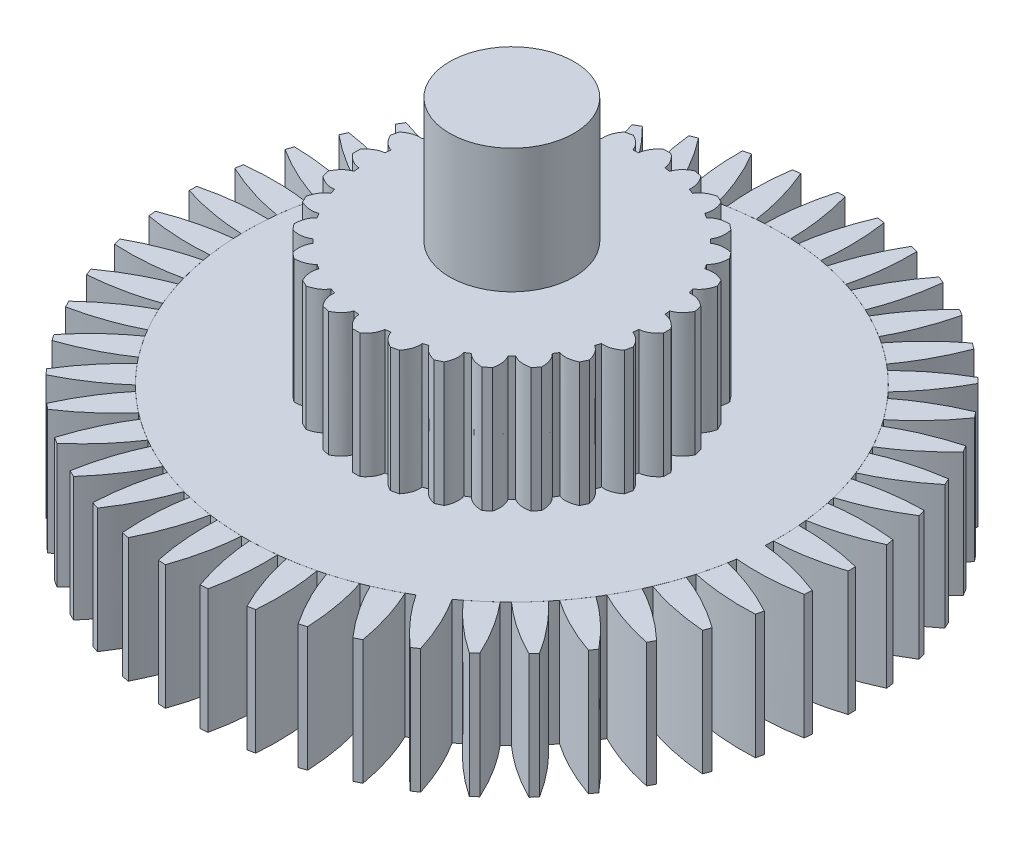
from build123d import *

# Parameters (mm, degrees)
BOSS_EXTRUDE1_DEPTH    = 1
BOSS_EXTRUDE1_2_DEPTH  = 1
BOSS_EXTRUDE1_3_DEPTH  = 1
BOSS_EXTRUDE1_4_DEPTH  = 1
BOSS_EXTRUDE1_5_DEPTH  = 1
BOSS_EXTRUDE1_6_DEPTH  = 1
BOSS_EXTRUDE1_7_DEPTH  = 1
BOSS_EXTRUDE1_8_DEPTH  = 1
BOSS_EXTRUDE1_9_DEPTH  = 1
BOSS_EXTRUDE1_10_DEPTH = 1
BOSS_EXTRUDE1_11_DEPTH = 1
BOSS_EXTRUDE1_12_DEPTH = 1
BOSS_EXTRUDE1_13_DEPTH = 1
BOSS_EXTRUDE1_14_DEPTH = 1
BOSS_EXTRUDE1_15_DEPTH = 1
BOSS_EXTRUDE1_16_DEPTH = 1
BOSS_EXTRUDE1_17_DEPTH = 1
BOSS_EXTRUDE1_18_DEPTH = 1
BOSS_EXTRUDE1_19_DEPTH = 1
BOSS_EXTRUDE1_20_DEPTH = 1
BOSS_EXTRUDE1_21_DEPTH = 1
BOSS_EXTRUDE1_22_DEPTH = 1
BOSS_EXTRUDE1_23_DEPTH = 1
BOSS_EXTRUDE1_24_DEPTH = 1
BOSS_EXTRUDE1_25_DEPTH = 1
BOSS_EXTRUDE1_26_DEPTH = 1
BOSS_EXTRUDE1_27_DEPTH = 1
BOSS_EXTRUDE1_28_DEPTH = 1
BOSS_EXTRUDE1_29_DEPTH = 1
BOSS_EXTRUDE1_30_DEPTH = 1
BOSS_EXTRUDE1_31_DEPTH = 1
BOSS_EXTRUDE1_32_DEPTH = 1
BOSS_EXTRUDE1_33_DEPTH = 1
BOSS_EXTRUDE1_34_DEPTH = 1
BOSS_EXTRUDE1_35_DEPTH = 1
BOSS_EXTRUDE1_36_DEPTH = 1
BOSS_EXTRUDE1_37_DEPTH = 1
BOSS_EXTRUDE1_38_DEPTH = 1
BOSS_EXTRUDE1_39_DEPTH = 1
BOSS_EXTRUDE1_40_DEPTH = 1
BOSS_EXTRUDE1_41_DEPTH = 1
BOSS_EXTRUDE1_42_DEPTH = 1
BOSS_EXTRUDE1_43_DEPTH = 1
BOSS_EXTRUDE1_44_DEPTH = 1
BOSS_EXTRUDE1_45_DEPTH = 1
BOSS_EXTRUDE1_46_DEPTH = 1
BOSS_EXTRUDE1_47_DEPTH = 1
BOSS_EXTRUDE1_48_DEPTH = 1
SKETCH2_R              = 1.13
BOSS_EXTRUDE11_DEPTH   = 1
BOSS_EXTRUDE12_DEPTH   = 1
SKETCH4_R              = 0.5
BOSS_EXTRUDE13_DEPTH   = 1
SKETCH5_R              = 0.5
BOSS_EXTRUDE14_DEPTH   = 1


with BuildPart() as part:
    # Sketch1 → Boss-Extrude1 (new body)
    with BuildSketch(Plane(origin=(0, 0, 0), x_dir=(1, 0, 0), z_dir=(0, 1, 0))):
        with BuildLine():
            Line((0.03, 2.65), (-0.03, 2.65))
            add(Edge.make_bspline(
                [(-0.03, 2.65), (-0.102282286, 2.396242435), (-0.105, 2.137422513)],
                knots=[0, 0, 0, 0.92752764, 0.92752764, 0.92752764], degree=2))
            ThreePointArc((-0.105, 2.137422513), (-0.052515815, 2.139355531), (0, 2.14))
            ThreePointArc((0, 2.14), (0.052515815, 2.139355531), (0.105, 2.137422513))
            add(Edge.make_bspline(
                [(0.03, 2.65), (0.102282286, 2.396242435), (0.105, 2.137422513)],
                knots=[0, 0, 0, 0.92752764, 0.92752764, 0.92752764], degree=2))
        make_face()
    extrude(amount=BOSS_EXTRUDE1_DEPTH)


with BuildPart() as body_2:
    # Sketch1 → Boss-Extrude1 2 (new body)
    with BuildSketch(Plane(origin=(0, 0, 0), x_dir=(1, 0, 0), z_dir=(0, 1, 0))):
        with BuildLine():
            Line((0, 2.14), (-0.105, 2.137422513))
            ThreePointArc((-0.105, 2.137422513), (-0.137110271, 2.13560314), (-0.169189573, 2.133301406))
            Line((-0.169189573, 2.133301406), (-0.273657126, 2.12243063))
            Line((-0.273657126, 2.12243063), (-0.377465476, 2.106447202))
            ThreePointArc((-0.377465476, 2.106447202), (-0.409079465, 2.100536596), (-0.440601058, 2.094151548))
            Line((-0.440601058, 2.094151548), (-0.54282081, 2.070011007))
            Line((-0.54282081, 2.070011007), (-0.643732979, 2.040884086))
            ThreePointArc((-0.643732979, 2.040884086), (-0.674331587, 2.030979299), (-0.704777885, 2.020615781))
            Line((-0.704777885, 2.020615781), (-0.80307139, 1.983601861))
            Line((-0.80307139, 1.983601861), (-0.899430404, 1.94180971))
            ThreePointArc((-0.899430404, 1.94180971), (-0.928511202, 1.928073377), (-0.957382279, 1.913901557))
            Line((-0.957382279, 1.913901557), (-1.050135561, 1.864622027))
            Line((-1.050135561, 1.864622027), (-1.140359207, 1.810850871))
            ThreePointArc((-1.140359207, 1.810850871), (-1.167444689, 1.793508544), (-1.194266483, 1.775761123))
            Line((-1.194266483, 1.775761123), (-1.279956535, 1.715025151))
            Line((-1.279956535, 1.715025151), (-1.362563344, 1.650157912))
            ThreePointArc((-1.362563344, 1.650157912), (-1.387208766, 1.629494351), (-1.411540864, 1.608462741))
            Line((-1.411540864, 1.608462741), (-1.488760658, 1.537267609))
            Line((-1.488760658, 1.537267609), (-1.562394227, 1.462369405))
            ThreePointArc((-1.562394227, 1.462369405), (-1.584194914, 1.438723905), (-1.605637783, 1.414753445))
            Line((-1.605637783, 1.414753445), (-1.673119372, 1.334268176))
            Line((-1.673119372, 1.334268176), (-1.736570641, 1.250568834))
            ThreePointArc((-1.736570641, 1.250568834), (-1.755168625, 1.224329653), (-1.773370174, 1.197813936))
            Line((-1.773370174, 1.197813936), (-1.830005513, 1.109360096))
            Line((-1.830005513, 1.109360096), (-1.882232613, 1.018233956))
            ThreePointArc((-1.882232613, 1.018233956), (-1.897322516, 0.989831941), (-1.911983876, 0.961206356))
            Line((-1.911983876, 0.961206356), (-1.956843013, 0.866236354))
            Line((-1.956843013, 0.866236354), (-1.996988378, 0.769179705))
            ThreePointArc((-1.996988378, 0.769179705), (-2.008322423, 0.739081216), (-2.019202855, 0.708815794))
            Line((-2.019202855, 0.708815794), (-2.051549205, 0.608889035))
            Line((-2.051549205, 0.608889035), (-2.078953648, 0.507495545))
            ThreePointArc((-2.078953648, 0.507495545), (-2.086345732, 0.476194799), (-2.09326658, 0.444786496))
            Line((-2.09326658, 0.444786496), (-2.112569017, 0.341543775))
            Line((-2.112569017, 0.341543775), (-2.126782557, 0.237478321))
            ThreePointArc((-2.126782557, 0.237478321), (-2.130111302, 0.205489275), (-2.132958925, 0.173453816))
            Line((-2.132958925, 0.173453816), (-2.138900503, 0.068590376))
            Line((-2.138900503, 0.068590376), (-2.139689756, -0.036438289))
            ThreePointArc((-2.139689756, -0.036438289), (-2.138900503, -0.068590376), (-2.137628143, -0.100726971))
            Line((-2.137628143, -0.100726971), (-2.130111302, -0.205489275))
            Line((-2.130111302, -0.205489275), (-2.117463307, -0.309756584))
            ThreePointArc((-2.117463307, -0.309756584), (-2.112569017, -0.341543775), (-2.107197566, -0.373253823))
            Line((-2.107197566, -0.373253823), (-2.086345732, -0.476194799))
            Line((-2.086345732, -0.476194799), (-2.06046817, -0.577988685))
            ThreePointArc((-2.06046817, -0.577988685), (-2.051549205, -0.608889035), (-2.042166864, -0.639651858))
            Line((-2.042166864, -0.639651858), (-2.008322423, -0.739081216))
            Line((-2.008322423, -0.739081216), (-1.969640203, -0.836730227))
            ThreePointArc((-1.969640203, -0.836730227), (-1.956843013, -0.866236354), (-1.943603838, -0.895546828))
            Line((-1.943603838, -0.895546828), (-1.897322516, -0.989831941))
            Line((-1.897322516, -0.989831941), (-1.846470797, -1.081732682))
            ThreePointArc((-1.846470797, -1.081732682), (-1.830005513, -1.109360096), (-1.813126891, -1.136736943))
            Line((-1.813126891, -1.136736943), (-1.755168625, -1.224329653))
            Line((-1.755168625, -1.224329653), (-1.692982392, -1.308973116))
            ThreePointArc((-1.692982392, -1.308973116), (-1.673119372, -1.334268176), (-1.65287845, -1.359261869))
            Line((-1.65287845, -1.359261869), (-1.584194914, -1.438723905))
            Line((-1.584194914, -1.438723905), (-1.511695264, -1.514720248))
            ThreePointArc((-1.511695264, -1.514720248), (-1.488760658, -1.537267609), (-1.465489791, -1.559467753))
            Line((-1.465489791, -1.559467753), (-1.387208766, -1.629494351))
            Line((-1.387208766, -1.629494351), (-1.30558614, -1.695595716))
            ThreePointArc((-1.30558614, -1.695595716), (-1.279956535, -1.715025151), (-1.254037831, -1.734067219))
            Line((-1.254037831, -1.734067219), (-1.167444689, -1.793508544))
            Line((-1.167444689, -1.793508544), (-1.078039329, -1.848629548))
            ThreePointArc((-1.078039329, -1.848629548), (-1.050135561, -1.864622027), (-1.021994603, -1.880193349))
            Line((-1.021994603, -1.880193349), (-0.928511202, -1.928073377))
            Line((-0.928511202, -1.928073377), (-0.832791141, -1.971308935))
            ThreePointArc((-0.832791141, -1.971308935), (-0.80307139, -1.983601861), (-0.773170253, -1.995446757))
            Line((-0.773170253, -1.995446757), (-0.674331587, -2.030979299))
            Line((-0.674331587, -2.030979299), (-0.573868546, -2.061619483))
            ThreePointArc((-0.573868546, -2.061619483), (-0.54282081, -2.070011007), (-0.511650468, -2.077934984))
            Line((-0.511650468, -2.077934984), (-0.409079465, -2.100536596))
            Line((-0.409079465, -2.100536596), (-0.305523045, -2.118078296))
            ThreePointArc((-0.305523045, -2.118078296), (-0.273657126, -2.12243063), (-0.241729397, -2.126303576))
            Line((-0.241729397, -2.126303576), (-0.137110271, -2.13560314))
            Line((-0.137110271, -2.13560314), (-0.032160864, -2.139758323))
            ThreePointArc((-0.032160864, -2.139758323), (0, -2.14), (0.032160864, -2.139758323))
            Line((0.032160864, -2.139758323), (0.137110271, -2.13560314))
            Line((0.137110271, -2.13560314), (0.241729397, -2.126303576))
            ThreePointArc((0.241729397, -2.126303576), (0.273657126, -2.12243063), (0.305523045, -2.118078296))
            Line((0.305523045, -2.118078296), (0.409079465, -2.100536596))
            Line((0.409079465, -2.100536596), (0.511650468, -2.077934984))
            ThreePointArc((0.511650468, -2.077934984), (0.54282081, -2.070011007), (0.573868546, -2.061619483))
            Line((0.573868546, -2.061619483), (0.674331587, -2.030979299))
            Line((0.674331587, -2.030979299), (0.773170253, -1.995446757))
            ThreePointArc((0.773170253, -1.995446757), (0.80307139, -1.983601861), (0.832791141, -1.971308935))
            Line((0.832791141, -1.971308935), (0.928511202, -1.928073377))
            Line((0.928511202, -1.928073377), (1.021994603, -1.880193349))
            ThreePointArc((1.021994603, -1.880193349), (1.050135561, -1.864622027), (1.078039329, -1.848629548))
            add(Edge.make_bspline(
                [(1.420524845, -2.237299525), (1.221512313, -2.064060838), (1.078039329, -1.848629548)],
                knots=[0, 0, 0, 0.92752764, 0.92752764, 0.92752764], degree=2))
            Line((1.420524845, -2.237299525), (1.470810131, -2.204567431))
            add(Edge.make_bspline(
                [(1.470810131, -2.204567431), (1.392955447, -1.952463725), (1.254037831, -1.734067219)],
                knots=[0, 0, 0, 0.92752764, 0.92752764, 0.92752764], degree=2))
            ThreePointArc((1.254037831, -1.734067219), (1.279956535, -1.715025151), (1.30558614, -1.695595716))
            Line((1.30558614, -1.695595716), (1.387208766, -1.629494351))
            Line((1.387208766, -1.629494351), (1.465489791, -1.559467753))
            ThreePointArc((1.465489791, -1.559467753), (1.488760658, -1.537267609), (1.511695264, -1.514720248))
            Line((1.511695264, -1.514720248), (1.584194914, -1.438723905))
            Line((1.584194914, -1.438723905), (1.65287845, -1.359261869))
            ThreePointArc((1.65287845, -1.359261869), (1.673119372, -1.334268176), (1.692982392, -1.308973116))
            Line((1.692982392, -1.308973116), (1.755168625, -1.224329653))
            Line((1.755168625, -1.224329653), (1.813126891, -1.136736943))
            ThreePointArc((1.813126891, -1.136736943), (1.830005513, -1.109360096), (1.846470797, -1.081732682))
            Line((1.846470797, -1.081732682), (1.897322516, -0.989831941))
            Line((1.897322516, -0.989831941), (1.943603838, -0.895546828))
            ThreePointArc((1.943603838, -0.895546828), (1.956843013, -0.866236354), (1.969640203, -0.836730227))
            Line((1.969640203, -0.836730227), (2.008322423, -0.739081216))
            Line((2.008322423, -0.739081216), (2.042166864, -0.639651858))
            ThreePointArc((2.042166864, -0.639651858), (2.051549205, -0.608889035), (2.06046817, -0.577988685))
            Line((2.06046817, -0.577988685), (2.086345732, -0.476194799))
            Line((2.086345732, -0.476194799), (2.107197566, -0.373253823))
            ThreePointArc((2.107197566, -0.373253823), (2.112569017, -0.341543775), (2.117463307, -0.309756584))
            add(Edge.make_bspline(
                [(2.634873959, -0.284322392), (2.375348215, -0.3319041), (2.117463307, -0.309756584)],
                knots=[0, 0, 0, 0.92752764, 0.92752764, 0.92752764], degree=2))
            Line((2.634873959, -0.284322392), (2.64063534, -0.224599645))
            add(Edge.make_bspline(
                [(2.64063534, -0.224599645), (2.394991124, -0.128284799), (2.137628143, -0.100726971)],
                knots=[0, 0, 0, 0.92752764, 0.92752764, 0.92752764], degree=2))
            ThreePointArc((2.137628143, -0.100726971), (2.138900503, -0.068590376), (2.139689756, -0.036438289))
            Line((2.139689756, -0.036438289), (2.138900503, 0.068590376))
            Line((2.138900503, 0.068590376), (2.132958925, 0.173453816))
            ThreePointArc((2.132958925, 0.173453816), (2.130111302, 0.205489275), (2.126782557, 0.237478321))
            Line((2.126782557, 0.237478321), (2.112569017, 0.341543775))
            Line((2.112569017, 0.341543775), (2.09326658, 0.444786496))
            ThreePointArc((2.09326658, 0.444786496), (2.086345732, 0.476194799), (2.078953648, 0.507495545))
            Line((2.078953648, 0.507495545), (2.051549205, 0.608889035))
            Line((2.051549205, 0.608889035), (2.019202855, 0.708815794))
            ThreePointArc((2.019202855, 0.708815794), (2.008322423, 0.739081216), (1.996988378, 0.769179705))
            Line((1.996988378, 0.769179705), (1.956843013, 0.866236354))
            Line((1.956843013, 0.866236354), (1.911983876, 0.961206356))
            ThreePointArc((1.911983876, 0.961206356), (1.897322516, 0.989831941), (1.882232613, 1.018233956))
            Line((1.882232613, 1.018233956), (1.830005513, 1.109360096))
            Line((1.830005513, 1.109360096), (1.773370174, 1.197813936))
            ThreePointArc((1.773370174, 1.197813936), (1.755168625, 1.224329653), (1.736570641, 1.250568834))
            Line((1.736570641, 1.250568834), (1.673119372, 1.334268176))
            Line((1.673119372, 1.334268176), (1.605637783, 1.414753445))
            ThreePointArc((1.605637783, 1.414753445), (1.584194914, 1.438723905), (1.562394227, 1.462369405))
            Line((1.562394227, 1.462369405), (1.488760658, 1.537267609))
            Line((1.488760658, 1.537267609), (1.411540864, 1.608462741))
            ThreePointArc((1.411540864, 1.608462741), (1.387208766, 1.629494351), (1.362563344, 1.650157912))
            Line((1.362563344, 1.650157912), (1.279956535, 1.715025151))
            Line((1.279956535, 1.715025151), (1.194266483, 1.775761123))
            ThreePointArc((1.194266483, 1.775761123), (1.167444689, 1.793508544), (1.140359207, 1.810850871))
            Line((1.140359207, 1.810850871), (1.050135561, 1.864622027))
            Line((1.050135561, 1.864622027), (0.957382279, 1.913901557))
            ThreePointArc((0.957382279, 1.913901557), (0.928511202, 1.928073377), (0.899430404, 1.94180971))
            Line((0.899430404, 1.94180971), (0.80307139, 1.983601861))
            Line((0.80307139, 1.983601861), (0.704777885, 2.020615781))
            ThreePointArc((0.704777885, 2.020615781), (0.674331587, 2.030979299), (0.643732979, 2.040884086))
            Line((0.643732979, 2.040884086), (0.54282081, 2.070011007))
            Line((0.54282081, 2.070011007), (0.440601058, 2.094151548))
            ThreePointArc((0.440601058, 2.094151548), (0.409079465, 2.100536596), (0.377465476, 2.106447202))
            Line((0.377465476, 2.106447202), (0.273657126, 2.12243063))
            Line((0.273657126, 2.12243063), (0.169189573, 2.133301406))
            ThreePointArc((0.169189573, 2.133301406), (0.137110271, 2.13560314), (0.105, 2.137422513))
            Line((0.105, 2.137422513), (0, 2.14))
        make_face()
    extrude(amount=BOSS_EXTRUDE1_2_DEPTH)

    # Sketch2 → Boss-Extrude11 (add)
    with BuildSketch(Plane(origin=(0, 1, 0), x_dir=(1, 0, 0), z_dir=(0, 1, 0))):
        Circle(SKETCH2_R)
    extrude(amount=BOSS_EXTRUDE11_DEPTH)

    # Sketch3 → Boss-Extrude12 (add)
    with BuildSketch(Plane(origin=(0, 2, 0), x_dir=(1, 0, 0), z_dir=(0, 1, 0))):
        with BuildLine():
            Line((-0.03, 1.25), (0.03, 1.25))
            add(Edge.make_bspline(
                [(0.03, 1.25), (0.100427355, 1.19375975), (0.105, 1.119897168)],
                knots=[0, 0, 0, 0.878062799, 0.878062799, 0.878062799], degree=2))
            Line((0.105, 1.119897168), (0, 1.13))
            Line((0, 1.13), (-0.105, 1.119897168))
            add(Edge.make_bspline(
                [(-0.03, 1.25), (-0.100427355, 1.19375975), (-0.105, 1.119897168)],
                knots=[0, 0, 0, 0.878062799, 0.878062799, 0.878062799], degree=2))
        make_face()
        with BuildLine():
            Line((0.24890333, 1.225335518), (0.307399005, 1.211984262))
            add(Edge.make_bspline(
                [(0.307399005, 1.211984262), (0.363545966, 1.141482512), (0.351567995, 1.06845431)],
                knots=[0, 0, 0, 0.878062799, 0.878062799, 0.878062799], degree=2))
            Line((0.351567995, 1.06845431), (0.251448655, 1.101668541))
            Line((0.251448655, 1.101668541), (0.146833133, 1.115183706))
            add(Edge.make_bspline(
                [(0.24890333, 1.225335518), (0.167727103, 1.18617689), (0.146833133, 1.115183706)],
                knots=[0, 0, 0, 0.878062799, 0.878062799, 0.878062799], degree=2))
        make_face()
        with BuildLine():
            Line((0.515325608, 1.139227597), (0.56938374, 1.113194573))
            add(Edge.make_bspline(
                [(0.56938374, 1.113194573), (0.608434864, 1.031966575), (0.580506902, 0.963434691)],
                knots=[0, 0, 0, 0.878062799, 0.878062799, 0.878062799], degree=2))
            Line((0.580506902, 0.963434691), (0.490288625, 1.018094821))
            Line((0.490288625, 1.018094821), (0.39130344, 1.054550276))
            add(Edge.make_bspline(
                [(0.515325608, 1.139227597), (0.427471024, 1.119114167), (0.39130344, 1.054550276)],
                knots=[0, 0, 0, 0.878062799, 0.878062799, 0.878062799], degree=2))
        make_face()
        with BuildLine():
            Line((0.755907308, 0.995994047), (0.802817197, 0.958584659))
            add(Edge.make_bspline(
                [(0.802817197, 0.958584659), (0.822814298, 0.870703524), (0.780336769, 0.810104434)],
                knots=[0, 0, 0, 0.878062799, 0.878062799, 0.878062799], degree=2))
            Line((0.780336769, 0.810104434), (0.704543476, 0.883469575))
            Line((0.704543476, 0.883469575), (0.616152158, 0.941037292))
            add(Edge.make_bspline(
                [(0.755907308, 0.995994047), (0.665779762, 0.995934387), (0.616152158, 0.941037292)],
                knots=[0, 0, 0, 0.878062799, 0.878062799, 0.878062799], degree=2))
        make_face()
        with BuildLine():
            Line((0.958584659, 0.802817197), (0.995994047, 0.755907308))
            add(Edge.make_bspline(
                [(0.995994047, 0.755907308), (0.995934387, 0.665779762), (0.941037292, 0.616152158)],
                knots=[0, 0, 0, 0.878062799, 0.878062799, 0.878062799], degree=2))
            Line((0.941037292, 0.616152158), (0.883469575, 0.704543476))
            Line((0.883469575, 0.704543476), (0.810104434, 0.780336769))
            add(Edge.make_bspline(
                [(0.958584659, 0.802817197), (0.870703524, 0.822814298), (0.810104434, 0.780336769)],
                knots=[0, 0, 0, 0.878062799, 0.878062799, 0.878062799], degree=2))
        make_face()
        with BuildLine():
            Line((1.113194573, 0.56938374), (1.139227597, 0.515325608))
            add(Edge.make_bspline(
                [(1.139227597, 0.515325608), (1.119114167, 0.427471024), (1.054550276, 0.39130344)],
                knots=[0, 0, 0, 0.878062799, 0.878062799, 0.878062799], degree=2))
            Line((1.054550276, 0.39130344), (1.018094821, 0.490288625))
            Line((1.018094821, 0.490288625), (0.963434691, 0.580506902))
            add(Edge.make_bspline(
                [(1.113194573, 0.56938374), (1.031966575, 0.608434864), (0.963434691, 0.580506902)],
                knots=[0, 0, 0, 0.878062799, 0.878062799, 0.878062799], degree=2))
        make_face()
        with BuildLine():
            Line((1.211984262, 0.307399005), (1.225335518, 0.24890333))
            add(Edge.make_bspline(
                [(1.225335518, 0.24890333), (1.18617689, 0.167727103), (1.115183706, 0.146833133)],
                knots=[0, 0, 0, 0.878062799, 0.878062799, 0.878062799], degree=2))
            Line((1.115183706, 0.146833133), (1.101668541, 0.251448655))
            Line((1.101668541, 0.251448655), (1.06845431, 0.351567995))
            add(Edge.make_bspline(
                [(1.211984262, 0.307399005), (1.141482512, 0.363545966), (1.06845431, 0.351567995)],
                knots=[0, 0, 0, 0.878062799, 0.878062799, 0.878062799], degree=2))
        make_face()
        with BuildLine():
            Line((1.25, 0.03), (1.25, -0.03))
            add(Edge.make_bspline(
                [(1.25, -0.03), (1.19375975, -0.100427355), (1.119897168, -0.105)],
                knots=[0, 0, 0, 0.878062799, 0.878062799, 0.878062799], degree=2))
            Line((1.119897168, -0.105), (1.13, 0))
            Line((1.13, 0), (1.119897168, 0.105))
            add(Edge.make_bspline(
                [(1.25, 0.03), (1.19375975, 0.100427355), (1.119897168, 0.105)],
                knots=[0, 0, 0, 0.878062799, 0.878062799, 0.878062799], degree=2))
        make_face()
        with BuildLine():
            Line((1.225335518, -0.24890333), (1.211984262, -0.307399005))
            add(Edge.make_bspline(
                [(1.211984262, -0.307399005), (1.141482512, -0.363545966), (1.06845431, -0.351567995)],
                knots=[0, 0, 0, 0.878062799, 0.878062799, 0.878062799], degree=2))
            Line((1.06845431, -0.351567995), (1.101668541, -0.251448655))
            Line((1.101668541, -0.251448655), (1.115183706, -0.146833133))
            add(Edge.make_bspline(
                [(1.225335518, -0.24890333), (1.18617689, -0.167727103), (1.115183706, -0.146833133)],
                knots=[0, 0, 0, 0.878062799, 0.878062799, 0.878062799], degree=2))
        make_face()
        with BuildLine():
            Line((1.139227597, -0.515325608), (1.113194573, -0.56938374))
            add(Edge.make_bspline(
                [(1.113194573, -0.56938374), (1.031966575, -0.608434864), (0.963434691, -0.580506902)],
                knots=[0, 0, 0, 0.878062799, 0.878062799, 0.878062799], degree=2))
            Line((0.963434691, -0.580506902), (1.018094821, -0.490288625))
            Line((1.018094821, -0.490288625), (1.054550276, -0.39130344))
            add(Edge.make_bspline(
                [(1.139227597, -0.515325608), (1.119114167, -0.427471024), (1.054550276, -0.39130344)],
                knots=[0, 0, 0, 0.878062799, 0.878062799, 0.878062799], degree=2))
        make_face()
        with BuildLine():
            Line((0.995994047, -0.755907308), (0.958584659, -0.802817197))
            add(Edge.make_bspline(
                [(0.958584659, -0.802817197), (0.870703524, -0.822814298), (0.810104434, -0.780336769)],
                knots=[0, 0, 0, 0.878062799, 0.878062799, 0.878062799], degree=2))
            Line((0.810104434, -0.780336769), (0.883469575, -0.704543476))
            Line((0.883469575, -0.704543476), (0.941037292, -0.616152158))
            add(Edge.make_bspline(
                [(0.995994047, -0.755907308), (0.995934387, -0.665779762), (0.941037292, -0.616152158)],
                knots=[0, 0, 0, 0.878062799, 0.878062799, 0.878062799], degree=2))
        make_face()
        with BuildLine():
            Line((0.802817197, -0.958584659), (0.755907308, -0.995994047))
            add(Edge.make_bspline(
                [(0.755907308, -0.995994047), (0.665779762, -0.995934387), (0.616152158, -0.941037292)],
                knots=[0, 0, 0, 0.878062799, 0.878062799, 0.878062799], degree=2))
            Line((0.616152158, -0.941037292), (0.704543476, -0.883469575))
            Line((0.704543476, -0.883469575), (0.780336769, -0.810104434))
            add(Edge.make_bspline(
                [(0.802817197, -0.958584659), (0.822814298, -0.870703524), (0.780336769, -0.810104434)],
                knots=[0, 0, 0, 0.878062799, 0.878062799, 0.878062799], degree=2))
        make_face()
        with BuildLine():
            Line((0.56938374, -1.113194573), (0.515325608, -1.139227597))
            add(Edge.make_bspline(
                [(0.515325608, -1.139227597), (0.427471024, -1.119114167), (0.39130344, -1.054550276)],
                knots=[0, 0, 0, 0.878062799, 0.878062799, 0.878062799], degree=2))
            Line((0.39130344, -1.054550276), (0.490288625, -1.018094821))
            Line((0.490288625, -1.018094821), (0.580506902, -0.963434691))
            add(Edge.make_bspline(
                [(0.56938374, -1.113194573), (0.608434864, -1.031966575), (0.580506902, -0.963434691)],
                knots=[0, 0, 0, 0.878062799, 0.878062799, 0.878062799], degree=2))
        make_face()
        with BuildLine():
            Line((0.307399005, -1.211984262), (0.24890333, -1.225335518))
            add(Edge.make_bspline(
                [(0.24890333, -1.225335518), (0.167727103, -1.18617689), (0.146833133, -1.115183706)],
                knots=[0, 0, 0, 0.878062799, 0.878062799, 0.878062799], degree=2))
            Line((0.146833133, -1.115183706), (0.251448655, -1.101668541))
            Line((0.251448655, -1.101668541), (0.351567995, -1.06845431))
            add(Edge.make_bspline(
                [(0.307399005, -1.211984262), (0.363545966, -1.141482512), (0.351567995, -1.06845431)],
                knots=[0, 0, 0, 0.878062799, 0.878062799, 0.878062799], degree=2))
        make_face()
        with BuildLine():
            Line((0.03, -1.25), (-0.03, -1.25))
            add(Edge.make_bspline(
                [(-0.03, -1.25), (-0.100427355, -1.19375975), (-0.105, -1.119897168)],
                knots=[0, 0, 0, 0.878062799, 0.878062799, 0.878062799], degree=2))
            Line((-0.105, -1.119897168), (0, -1.13))
            Line((0, -1.13), (0.105, -1.119897168))
            add(Edge.make_bspline(
                [(0.03, -1.25), (0.100427355, -1.19375975), (0.105, -1.119897168)],
                knots=[0, 0, 0, 0.878062799, 0.878062799, 0.878062799], degree=2))
        make_face()
        with BuildLine():
            Line((-0.24890333, -1.225335518), (-0.307399005, -1.211984262))
            add(Edge.make_bspline(
                [(-0.307399005, -1.211984262), (-0.363545966, -1.141482512), (-0.351567995, -1.06845431)],
                knots=[0, 0, 0, 0.878062799, 0.878062799, 0.878062799], degree=2))
            Line((-0.351567995, -1.06845431), (-0.251448655, -1.101668541))
            Line((-0.251448655, -1.101668541), (-0.146833133, -1.115183706))
            add(Edge.make_bspline(
                [(-0.24890333, -1.225335518), (-0.167727103, -1.18617689), (-0.146833133, -1.115183706)],
                knots=[0, 0, 0, 0.878062799, 0.878062799, 0.878062799], degree=2))
        make_face()
        with BuildLine():
            Line((-0.515325608, -1.139227597), (-0.56938374, -1.113194573))
            add(Edge.make_bspline(
                [(-0.56938374, -1.113194573), (-0.608434864, -1.031966575), (-0.580506902, -0.963434691)],
                knots=[0, 0, 0, 0.878062799, 0.878062799, 0.878062799], degree=2))
            Line((-0.580506902, -0.963434691), (-0.490288625, -1.018094821))
            Line((-0.490288625, -1.018094821), (-0.39130344, -1.054550276))
            add(Edge.make_bspline(
                [(-0.515325608, -1.139227597), (-0.427471024, -1.119114167), (-0.39130344, -1.054550276)],
                knots=[0, 0, 0, 0.878062799, 0.878062799, 0.878062799], degree=2))
        make_face()
        with BuildLine():
            Line((-0.755907308, -0.995994047), (-0.802817197, -0.958584659))
            add(Edge.make_bspline(
                [(-0.802817197, -0.958584659), (-0.822814298, -0.870703524), (-0.780336769, -0.810104434)],
                knots=[0, 0, 0, 0.878062799, 0.878062799, 0.878062799], degree=2))
            Line((-0.780336769, -0.810104434), (-0.704543476, -0.883469575))
            Line((-0.704543476, -0.883469575), (-0.616152158, -0.941037292))
            add(Edge.make_bspline(
                [(-0.755907308, -0.995994047), (-0.665779762, -0.995934387), (-0.616152158, -0.941037292)],
                knots=[0, 0, 0, 0.878062799, 0.878062799, 0.878062799], degree=2))
        make_face()
        with BuildLine():
            Line((-0.958584659, -0.802817197), (-0.995994047, -0.755907308))
            add(Edge.make_bspline(
                [(-0.995994047, -0.755907308), (-0.995934387, -0.665779762), (-0.941037292, -0.616152158)],
                knots=[0, 0, 0, 0.878062799, 0.878062799, 0.878062799], degree=2))
            Line((-0.941037292, -0.616152158), (-0.883469575, -0.704543476))
            Line((-0.883469575, -0.704543476), (-0.810104434, -0.780336769))
            add(Edge.make_bspline(
                [(-0.958584659, -0.802817197), (-0.870703524, -0.822814298), (-0.810104434, -0.780336769)],
                knots=[0, 0, 0, 0.878062799, 0.878062799, 0.878062799], degree=2))
        make_face()
        with BuildLine():
            Line((-1.113194573, -0.56938374), (-1.139227597, -0.515325608))
            add(Edge.make_bspline(
                [(-1.139227597, -0.515325608), (-1.119114167, -0.427471024), (-1.054550276, -0.39130344)],
                knots=[0, 0, 0, 0.878062799, 0.878062799, 0.878062799], degree=2))
            Line((-1.054550276, -0.39130344), (-1.018094821, -0.490288625))
            Line((-1.018094821, -0.490288625), (-0.963434691, -0.580506902))
            add(Edge.make_bspline(
                [(-1.113194573, -0.56938374), (-1.031966575, -0.608434864), (-0.963434691, -0.580506902)],
                knots=[0, 0, 0, 0.878062799, 0.878062799, 0.878062799], degree=2))
        make_face()
        with BuildLine():
            Line((-1.211984262, -0.307399005), (-1.225335518, -0.24890333))
            add(Edge.make_bspline(
                [(-1.225335518, -0.24890333), (-1.18617689, -0.167727103), (-1.115183706, -0.146833133)],
                knots=[0, 0, 0, 0.878062799, 0.878062799, 0.878062799], degree=2))
            Line((-1.115183706, -0.146833133), (-1.101668541, -0.251448655))
            Line((-1.101668541, -0.251448655), (-1.06845431, -0.351567995))
            add(Edge.make_bspline(
                [(-1.211984262, -0.307399005), (-1.141482512, -0.363545966), (-1.06845431, -0.351567995)],
                knots=[0, 0, 0, 0.878062799, 0.878062799, 0.878062799], degree=2))
        make_face()
        with BuildLine():
            Line((-1.25, -0.03), (-1.25, 0.03))
            add(Edge.make_bspline(
                [(-1.25, 0.03), (-1.19375975, 0.100427355), (-1.119897168, 0.105)],
                knots=[0, 0, 0, 0.878062799, 0.878062799, 0.878062799], degree=2))
            Line((-1.119897168, 0.105), (-1.13, 0))
            Line((-1.13, 0), (-1.119897168, -0.105))
            add(Edge.make_bspline(
                [(-1.25, -0.03), (-1.19375975, -0.100427355), (-1.119897168, -0.105)],
                knots=[0, 0, 0, 0.878062799, 0.878062799, 0.878062799], degree=2))
        make_face()
        with BuildLine():
            Line((-1.225335518, 0.24890333), (-1.211984262, 0.307399005))
            add(Edge.make_bspline(
                [(-1.211984262, 0.307399005), (-1.141482512, 0.363545966), (-1.06845431, 0.351567995)],
                knots=[0, 0, 0, 0.878062799, 0.878062799, 0.878062799], degree=2))
            Line((-1.06845431, 0.351567995), (-1.101668541, 0.251448655))
            Line((-1.101668541, 0.251448655), (-1.115183706, 0.146833133))
            add(Edge.make_bspline(
                [(-1.225335518, 0.24890333), (-1.18617689, 0.167727103), (-1.115183706, 0.146833133)],
                knots=[0, 0, 0, 0.878062799, 0.878062799, 0.878062799], degree=2))
        make_face()
        with BuildLine():
            Line((-1.139227597, 0.515325608), (-1.113194573, 0.56938374))
            add(Edge.make_bspline(
                [(-1.113194573, 0.56938374), (-1.031966575, 0.608434864), (-0.963434691, 0.580506902)],
                knots=[0, 0, 0, 0.878062799, 0.878062799, 0.878062799], degree=2))
            Line((-0.963434691, 0.580506902), (-1.018094821, 0.490288625))
            Line((-1.018094821, 0.490288625), (-1.054550276, 0.39130344))
            add(Edge.make_bspline(
                [(-1.139227597, 0.515325608), (-1.119114167, 0.427471024), (-1.054550276, 0.39130344)],
                knots=[0, 0, 0, 0.878062799, 0.878062799, 0.878062799], degree=2))
        make_face()
        with BuildLine():
            Line((-0.995994047, 0.755907308), (-0.958584659, 0.802817197))
            add(Edge.make_bspline(
                [(-0.958584659, 0.802817197), (-0.870703524, 0.822814298), (-0.810104434, 0.780336769)],
                knots=[0, 0, 0, 0.878062799, 0.878062799, 0.878062799], degree=2))
            Line((-0.810104434, 0.780336769), (-0.883469575, 0.704543476))
            Line((-0.883469575, 0.704543476), (-0.941037292, 0.616152158))
            add(Edge.make_bspline(
                [(-0.995994047, 0.755907308), (-0.995934387, 0.665779762), (-0.941037292, 0.616152158)],
                knots=[0, 0, 0, 0.878062799, 0.878062799, 0.878062799], degree=2))
        make_face()
        with BuildLine():
            Line((-0.802817197, 0.958584659), (-0.755907308, 0.995994047))
            add(Edge.make_bspline(
                [(-0.755907308, 0.995994047), (-0.665779762, 0.995934387), (-0.616152158, 0.941037292)],
                knots=[0, 0, 0, 0.878062799, 0.878062799, 0.878062799], degree=2))
            Line((-0.616152158, 0.941037292), (-0.704543476, 0.883469575))
            Line((-0.704543476, 0.883469575), (-0.780336769, 0.810104434))
            add(Edge.make_bspline(
                [(-0.802817197, 0.958584659), (-0.822814298, 0.870703524), (-0.780336769, 0.810104434)],
                knots=[0, 0, 0, 0.878062799, 0.878062799, 0.878062799], degree=2))
        make_face()
        with BuildLine():
            Line((-0.56938374, 1.113194573), (-0.515325608, 1.139227597))
            add(Edge.make_bspline(
                [(-0.515325608, 1.139227597), (-0.427471024, 1.119114167), (-0.39130344, 1.054550276)],
                knots=[0, 0, 0, 0.878062799, 0.878062799, 0.878062799], degree=2))
            Line((-0.39130344, 1.054550276), (-0.490288625, 1.018094821))
            Line((-0.490288625, 1.018094821), (-0.580506902, 0.963434691))
            add(Edge.make_bspline(
                [(-0.56938374, 1.113194573), (-0.608434864, 1.031966575), (-0.580506902, 0.963434691)],
                knots=[0, 0, 0, 0.878062799, 0.878062799, 0.878062799], degree=2))
        make_face()
        with BuildLine():
            Line((-0.307399005, 1.211984262), (-0.24890333, 1.225335518))
            add(Edge.make_bspline(
                [(-0.24890333, 1.225335518), (-0.167727103, 1.18617689), (-0.146833133, 1.115183706)],
                knots=[0, 0, 0, 0.878062799, 0.878062799, 0.878062799], degree=2))
            Line((-0.146833133, 1.115183706), (-0.251448655, 1.101668541))
            Line((-0.251448655, 1.101668541), (-0.351567995, 1.06845431))
            add(Edge.make_bspline(
                [(-0.307399005, 1.211984262), (-0.363545966, 1.141482512), (-0.351567995, 1.06845431)],
                knots=[0, 0, 0, 0.878062799, 0.878062799, 0.878062799], degree=2))
        make_face()
    extrude(amount=-BOSS_EXTRUDE12_DEPTH)

    # Sketch4 → Boss-Extrude13 (add)
    with BuildSketch(Plane(origin=(0, 2, 0), x_dir=(1, 0, 0), z_dir=(0, 1, 0))):
        Circle(SKETCH4_R)
    extrude(amount=BOSS_EXTRUDE13_DEPTH)

    # Sketch5 → Boss-Extrude14 (add)
    with BuildSketch(Plane.XZ):
        Circle(SKETCH5_R)
    extrude(amount=BOSS_EXTRUDE14_DEPTH)


with BuildPart() as body_3:
    # Sketch1 → Boss-Extrude1 3 (new body)
    with BuildSketch(Plane(origin=(0, 0, 0), x_dir=(1, 0, 0), z_dir=(0, 1, 0))):
        with BuildLine():
            ThreePointArc((-0.273657126, 2.12243063), (-0.221490052, 2.128507025), (-0.169189573, 2.133301406))
            add(Edge.make_bspline(
                [(-0.309120778, 2.632079851), (-0.204982132, 2.389648886), (-0.169189573, 2.133301406)],
                knots=[0, 0, 0, 0.92752764, 0.92752764, 0.92752764], degree=2))
            Line((-0.309120778, 2.632079851), (-0.368628179, 2.624407222))
            add(Edge.make_bspline(
                [(-0.368628179, 2.624407222), (-0.407867231, 2.36348975), (-0.377465476, 2.106447202)],
                knots=[0, 0, 0, 0.92752764, 0.92752764, 0.92752764], degree=2))
            ThreePointArc((-0.377465476, 2.106447202), (-0.325659374, 2.115075879), (-0.273657126, 2.12243063))
        make_face()
    extrude(amount=BOSS_EXTRUDE1_3_DEPTH)


with BuildPart() as body_4:
    # Sketch1 → Boss-Extrude1 4 (new body)
    with BuildSketch(Plane(origin=(0, 0, 0), x_dir=(1, 0, 0), z_dir=(0, 1, 0))):
        with BuildLine():
            add(Edge.make_bspline(
                [(0.309120778, 2.632079851), (0.204982132, 2.389648886), (0.169189573, 2.133301406)],
                knots=[0, 0, 0, 0.92752764, 0.92752764, 0.92752764], degree=2))
            ThreePointArc((0.169189573, 2.133301406), (0.221490052, 2.128507025), (0.273657126, 2.12243063))
            ThreePointArc((0.273657126, 2.12243063), (0.325659374, 2.115075879), (0.377465476, 2.106447202))
            add(Edge.make_bspline(
                [(0.368628179, 2.624407222), (0.407867231, 2.36348975), (0.377465476, 2.106447202)],
                knots=[0, 0, 0, 0.92752764, 0.92752764, 0.92752764], degree=2))
            Line((0.368628179, 2.624407222), (0.309120778, 2.632079851))
        make_face()
    extrude(amount=BOSS_EXTRUDE1_4_DEPTH)


with BuildPart() as body_5:
    # Sketch1 → Boss-Extrude1 5 (new body)
    with BuildSketch(Plane(origin=(0, 0, 0), x_dir=(1, 0, 0), z_dir=(0, 1, 0))):
        with BuildLine():
            ThreePointArc((-0.54282081, 2.070011007), (-0.491859059, 2.082708493), (-0.440601058, 2.094151548))
            add(Edge.make_bspline(
                [(-0.643165801, 2.570941025), (-0.508880748, 2.343817369), (-0.440601058, 2.094151548)],
                knots=[0, 0, 0, 0.92752764, 0.92752764, 0.92752764], degree=2))
            Line((-0.643165801, 2.570941025), (-0.701203493, 2.55572175))
            add(Edge.make_bspline(
                [(-0.701203493, 2.55572175), (-0.706755007, 2.291928628), (-0.643732979, 2.040884086)],
                knots=[0, 0, 0, 0.92752764, 0.92752764, 0.92752764], degree=2))
            ThreePointArc((-0.643732979, 2.040884086), (-0.593455616, 2.056066738), (-0.54282081, 2.070011007))
        make_face()
    extrude(amount=BOSS_EXTRUDE1_5_DEPTH)


with BuildPart() as body_6:
    # Sketch1 → Boss-Extrude1 6 (new body)
    with BuildSketch(Plane(origin=(0, 0, 0), x_dir=(1, 0, 0), z_dir=(0, 1, 0))):
        with BuildLine():
            add(Edge.make_bspline(
                [(0.643165801, 2.570941025), (0.508880748, 2.343817369), (0.440601058, 2.094151548)],
                knots=[0, 0, 0, 0.92752764, 0.92752764, 0.92752764], degree=2))
            ThreePointArc((0.440601058, 2.094151548), (0.491859059, 2.082708493), (0.54282081, 2.070011007))
            ThreePointArc((0.54282081, 2.070011007), (0.593455616, 2.056066738), (0.643732979, 2.040884086))
            add(Edge.make_bspline(
                [(0.701203493, 2.55572175), (0.706755007, 2.291928628), (0.643732979, 2.040884086)],
                knots=[0, 0, 0, 0.92752764, 0.92752764, 0.92752764], degree=2))
            Line((0.701203493, 2.55572175), (0.643165801, 2.570941025))
        make_face()
    extrude(amount=BOSS_EXTRUDE1_6_DEPTH)


with BuildPart() as body_7:
    # Sketch1 → Boss-Extrude1 7 (new body)
    with BuildSketch(Plane(origin=(0, 0, 0), x_dir=(1, 0, 0), z_dir=(0, 1, 0))):
        with BuildLine():
            ThreePointArc((-0.80307139, 1.983601861), (-0.754151753, 2.002711945), (-0.704777885, 2.020615781))
            add(Edge.make_bspline(
                [(-0.96665006, 2.467587417), (-0.804423557, 2.259500435), (-0.704777885, 2.020615781)],
                knots=[0, 0, 0, 0.92752764, 0.92752764, 0.92752764], degree=2))
            Line((-0.96665006, 2.467587417), (-1.022265066, 2.445071397))
            add(Edge.make_bspline(
                [(-1.022265066, 2.445071397), (-0.994037886, 2.182734101), (-0.899430404, 1.94180971)],
                knots=[0, 0, 0, 0.92752764, 0.92752764, 0.92752764], degree=2))
            ThreePointArc((-0.899430404, 1.94180971), (-0.851507332, 1.963297039), (-0.80307139, 1.983601861))
        make_face()
    extrude(amount=BOSS_EXTRUDE1_7_DEPTH)


with BuildPart() as body_8:
    # Sketch1 → Boss-Extrude1 8 (new body)
    with BuildSketch(Plane(origin=(0, 0, 0), x_dir=(1, 0, 0), z_dir=(0, 1, 0))):
        with BuildLine():
            add(Edge.make_bspline(
                [(0.96665006, 2.467587417), (0.804423557, 2.259500435), (0.704777885, 2.020615781)],
                knots=[0, 0, 0, 0.92752764, 0.92752764, 0.92752764], degree=2))
            ThreePointArc((0.704777885, 2.020615781), (0.754151753, 2.002711945), (0.80307139, 1.983601861))
            ThreePointArc((0.80307139, 1.983601861), (0.851507332, 1.963297039), (0.899430404, 1.94180971))
            add(Edge.make_bspline(
                [(1.022265066, 2.445071397), (0.994037886, 2.182734101), (0.899430404, 1.94180971)],
                knots=[0, 0, 0, 0.92752764, 0.92752764, 0.92752764], degree=2))
            Line((1.022265066, 2.445071397), (0.96665006, 2.467587417))
        make_face()
    extrude(amount=BOSS_EXTRUDE1_8_DEPTH)


with BuildPart() as body_9:
    # Sketch1 → Boss-Extrude1 9 (new body)
    with BuildSketch(Plane(origin=(0, 0, 0), x_dir=(1, 0, 0), z_dir=(0, 1, 0))):
        with BuildLine():
            ThreePointArc((-1.050135561, 1.864622027), (-1.004061297, 1.889830921), (-0.957382279, 1.913901557))
            add(Edge.make_bspline(
                [(-1.274261952, 2.323716092), (-1.086757753, 2.138082566), (-0.957382279, 1.913901557)],
                knots=[0, 0, 0, 0.92752764, 0.92752764, 0.92752764], degree=2))
            Line((-1.274261952, 2.323716092), (-1.326541074, 2.294273039))
            add(Edge.make_bspline(
                [(-1.326541074, 2.294273039), (-1.264998691, 2.037699141), (-1.140359207, 1.810850871)],
                knots=[0, 0, 0, 0.92752764, 0.92752764, 0.92752764], degree=2))
            ThreePointArc((-1.140359207, 1.810850871), (-1.095577321, 1.838290057), (-1.050135561, 1.864622027))
        make_face()
    extrude(amount=BOSS_EXTRUDE1_9_DEPTH)


with BuildPart() as body_10:
    # Sketch1 → Boss-Extrude1 10 (new body)
    with BuildSketch(Plane(origin=(0, 0, 0), x_dir=(1, 0, 0), z_dir=(0, 1, 0))):
        with BuildLine():
            add(Edge.make_bspline(
                [(1.274261952, 2.323716092), (1.086757753, 2.138082566), (0.957382279, 1.913901557)],
                knots=[0, 0, 0, 0.92752764, 0.92752764, 0.92752764], degree=2))
            ThreePointArc((0.957382279, 1.913901557), (1.004061297, 1.889830921), (1.050135561, 1.864622027))
            ThreePointArc((1.050135561, 1.864622027), (1.095577321, 1.838290057), (1.140359207, 1.810850871))
            add(Edge.make_bspline(
                [(1.326541074, 2.294273039), (1.264998691, 2.037699141), (1.140359207, 1.810850871)],
                knots=[0, 0, 0, 0.92752764, 0.92752764, 0.92752764], degree=2))
            Line((1.326541074, 2.294273039), (1.274261952, 2.323716092))
        make_face()
    extrude(amount=BOSS_EXTRUDE1_10_DEPTH)


with BuildPart() as body_11:
    # Sketch1 → Boss-Extrude1 11 (new body)
    with BuildSketch(Plane(origin=(0, 0, 0), x_dir=(1, 0, 0), z_dir=(0, 1, 0))):
        with BuildLine():
            ThreePointArc((-1.279956535, 1.715025151), (-1.237484182, 1.745918927), (-1.194266483, 1.775761123))
            add(Edge.make_bspline(
                [(-1.560950497, 2.141689414), (-1.351247417, 1.981557441), (-1.194266483, 1.775761123)],
                knots=[0, 0, 0, 0.92752764, 0.92752764, 0.92752764], degree=2))
            Line((-1.560950497, 2.141689414), (-1.609035314, 2.105802782))
            add(Edge.make_bspline(
                [(-1.609035314, 2.105802782), (-1.515188251, 1.859205217), (-1.362563344, 1.650157912)],
                knots=[0, 0, 0, 0.92752764, 0.92752764, 0.92752764], degree=2))
            ThreePointArc((-1.362563344, 1.650157912), (-1.321657961, 1.683098403), (-1.279956535, 1.715025151))
        make_face()
    extrude(amount=BOSS_EXTRUDE1_11_DEPTH)


with BuildPart() as body_12:
    # Sketch1 → Boss-Extrude1 12 (new body)
    with BuildSketch(Plane(origin=(0, 0, 0), x_dir=(1, 0, 0), z_dir=(0, 1, 0))):
        with BuildLine():
            add(Edge.make_bspline(
                [(1.560950497, 2.141689414), (1.351247417, 1.981557441), (1.194266483, 1.775761123)],
                knots=[0, 0, 0, 0.92752764, 0.92752764, 0.92752764], degree=2))
            ThreePointArc((1.194266483, 1.775761123), (1.237484182, 1.745918927), (1.279956535, 1.715025151))
            ThreePointArc((1.279956535, 1.715025151), (1.321657961, 1.683098403), (1.362563344, 1.650157912))
            add(Edge.make_bspline(
                [(1.609035314, 2.105802782), (1.515188251, 1.859205217), (1.362563344, 1.650157912)],
                knots=[0, 0, 0, 0.92752764, 0.92752764, 0.92752764], degree=2))
            Line((1.609035314, 2.105802782), (1.560950497, 2.141689414))
        make_face()
    extrude(amount=BOSS_EXTRUDE1_12_DEPTH)


with BuildPart() as body_13:
    # Sketch1 → Boss-Extrude1 13 (new body)
    with BuildSketch(Plane(origin=(0, 0, 0), x_dir=(1, 0, 0), z_dir=(0, 1, 0))):
        with BuildLine():
            ThreePointArc((-1.488760658, 1.537267609), (-1.450587611, 1.573338992), (-1.411540864, 1.608462741))
            add(Edge.make_bspline(
                [(-1.822008279, 1.924496254), (-1.593549636, 1.792495197), (-1.411540864, 1.608462741)],
                knots=[0, 0, 0, 0.92752764, 0.92752764, 0.92752764], degree=2))
            Line((-1.822008279, 1.924496254), (-1.86510924, 1.882755301))
            add(Edge.make_bspline(
                [(-1.86510924, 1.882755301), (-1.740498463, 1.650183195), (-1.562394227, 1.462369405)],
                knots=[0, 0, 0, 0.92752764, 0.92752764, 0.92752764], degree=2))
            ThreePointArc((-1.562394227, 1.462369405), (-1.526037014, 1.500270319), (-1.488760658, 1.537267609))
        make_face()
    extrude(amount=BOSS_EXTRUDE1_13_DEPTH)


with BuildPart() as body_14:
    # Sketch1 → Boss-Extrude1 14 (new body)
    with BuildSketch(Plane(origin=(0, 0, 0), x_dir=(1, 0, 0), z_dir=(0, 1, 0))):
        with BuildLine():
            add(Edge.make_bspline(
                [(1.822008279, 1.924496254), (1.593549636, 1.792495197), (1.411540864, 1.608462741)],
                knots=[0, 0, 0, 0.92752764, 0.92752764, 0.92752764], degree=2))
            ThreePointArc((1.411540864, 1.608462741), (1.450587611, 1.573338992), (1.488760658, 1.537267609))
            ThreePointArc((1.488760658, 1.537267609), (1.526037014, 1.500270319), (1.562394227, 1.462369405))
            add(Edge.make_bspline(
                [(1.86510924, 1.882755301), (1.740498463, 1.650183195), (1.562394227, 1.462369405)],
                knots=[0, 0, 0, 0.92752764, 0.92752764, 0.92752764], degree=2))
            Line((1.86510924, 1.882755301), (1.822008279, 1.924496254))
        make_face()
    extrude(amount=BOSS_EXTRUDE1_14_DEPTH)


with BuildPart() as body_15:
    # Sketch1 → Boss-Extrude1 15 (new body)
    with BuildSketch(Plane(origin=(0, 0, 0), x_dir=(1, 0, 0), z_dir=(0, 1, 0))):
        with BuildLine():
            ThreePointArc((-1.673119372, 1.334268176), (-1.639872431, 1.374924874), (-1.605637783, 1.414753445))
            add(Edge.make_bspline(
                [(-2.053148734, 1.675702919), (-1.809685813, 1.574000232), (-1.605637783, 1.414753445)],
                knots=[0, 0, 0, 0.92752764, 0.92752764, 0.92752764], degree=2))
            Line((-2.053148734, 1.675702919), (-2.090558123, 1.62879303))
            add(Edge.make_bspline(
                [(-2.090558123, 1.62879303), (-1.937229738, 1.41406521), (-1.736570641, 1.250568834)],
                knots=[0, 0, 0, 0.92752764, 0.92752764, 0.92752764], degree=2))
            ThreePointArc((-1.736570641, 1.250568834), (-1.705358582, 1.292807839), (-1.673119372, 1.334268176))
        make_face()
    extrude(amount=BOSS_EXTRUDE1_15_DEPTH)


with BuildPart() as body_16:
    # Sketch1 → Boss-Extrude1 16 (new body)
    with BuildSketch(Plane(origin=(0, 0, 0), x_dir=(1, 0, 0), z_dir=(0, 1, 0))):
        with BuildLine():
            add(Edge.make_bspline(
                [(2.053148734, 1.675702919), (1.809685813, 1.574000232), (1.605637783, 1.414753445)],
                knots=[0, 0, 0, 0.92752764, 0.92752764, 0.92752764], degree=2))
            ThreePointArc((1.605637783, 1.414753445), (1.639872431, 1.374924874), (1.673119372, 1.334268176))
            ThreePointArc((1.673119372, 1.334268176), (1.705358582, 1.292807839), (1.736570641, 1.250568834))
            add(Edge.make_bspline(
                [(2.090558123, 1.62879303), (1.937229738, 1.41406521), (1.736570641, 1.250568834)],
                knots=[0, 0, 0, 0.92752764, 0.92752764, 0.92752764], degree=2))
            Line((2.090558123, 1.62879303), (2.053148734, 1.675702919))
        make_face()
    extrude(amount=BOSS_EXTRUDE1_16_DEPTH)


with BuildPart() as body_17:
    # Sketch1 → Boss-Extrude1 17 (new body)
    with BuildSketch(Plane(origin=(0, 0, 0), x_dir=(1, 0, 0), z_dir=(0, 1, 0))):
        with BuildLine():
            ThreePointArc((-1.830005513, 1.109360096), (-1.802230592, 1.153934528), (-1.773370174, 1.197813936))
            add(Edge.make_bspline(
                [(-2.250576545, 1.399394589), (-1.996107, 1.329660227), (-1.773370174, 1.197813936)],
                knots=[0, 0, 0, 0.92752764, 0.92752764, 0.92752764], degree=2))
            Line((-2.250576545, 1.399394589), (-2.281680099, 1.348086023))
            add(Edge.make_bspline(
                [(-2.281680099, 1.348086023), (-2.102151754, 1.154728314), (-1.882232613, 1.018233956)],
                knots=[0, 0, 0, 0.92752764, 0.92752764, 0.92752764], degree=2))
            ThreePointArc((-1.882232613, 1.018233956), (-1.856678208, 1.064117489), (-1.830005513, 1.109360096))
        make_face()
    extrude(amount=BOSS_EXTRUDE1_17_DEPTH)


with BuildPart() as body_18:
    # Sketch1 → Boss-Extrude1 18 (new body)
    with BuildSketch(Plane(origin=(0, 0, 0), x_dir=(1, 0, 0), z_dir=(0, 1, 0))):
        with BuildLine():
            add(Edge.make_bspline(
                [(2.250576545, 1.399394589), (1.996107, 1.329660227), (1.773370174, 1.197813936)],
                knots=[0, 0, 0, 0.92752764, 0.92752764, 0.92752764], degree=2))
            ThreePointArc((1.773370174, 1.197813936), (1.802230592, 1.153934528), (1.830005513, 1.109360096))
            ThreePointArc((1.830005513, 1.109360096), (1.856678208, 1.064117489), (1.882232613, 1.018233956))
            add(Edge.make_bspline(
                [(2.281680099, 1.348086023), (2.102151754, 1.154728314), (1.882232613, 1.018233956)],
                knots=[0, 0, 0, 0.92752764, 0.92752764, 0.92752764], degree=2))
            Line((2.281680099, 1.348086023), (2.250576545, 1.399394589))
        make_face()
    extrude(amount=BOSS_EXTRUDE1_18_DEPTH)


with BuildPart() as body_19:
    # Sketch1 → Boss-Extrude1 19 (new body)
    with BuildSketch(Plane(origin=(0, 0, 0), x_dir=(1, 0, 0), z_dir=(0, 1, 0))):
        with BuildLine():
            ThreePointArc((-1.956843013, 0.866236354), (-1.934996176, 0.913996609), (-1.911983876, 0.961206356))
            add(Edge.make_bspline(
                [(-2.411049951, 1.100108238), (-2.149752165, 1.063487237), (-1.911983876, 0.961206356)],
                knots=[0, 0, 0, 0.92752764, 0.92752764, 0.92752764], degree=2))
            Line((-2.411049951, 1.100108238), (-2.435336951, 1.045243481))
            add(Edge.make_bspline(
                [(-2.435336951, 1.045243481), (-2.232556496, 0.876430811), (-1.996988378, 0.769179705)],
                knots=[0, 0, 0, 0.92752764, 0.92752764, 0.92752764], degree=2))
            ThreePointArc((-1.996988378, 0.769179705), (-1.97751123, 0.81795436), (-1.956843013, 0.866236354))
        make_face()
    extrude(amount=BOSS_EXTRUDE1_19_DEPTH)


with BuildPart() as body_20:
    # Sketch1 → Boss-Extrude1 20 (new body)
    with BuildSketch(Plane(origin=(0, 0, 0), x_dir=(1, 0, 0), z_dir=(0, 1, 0))):
        with BuildLine():
            add(Edge.make_bspline(
                [(2.411049951, 1.100108238), (2.149752165, 1.063487237), (1.911983876, 0.961206356)],
                knots=[0, 0, 0, 0.92752764, 0.92752764, 0.92752764], degree=2))
            ThreePointArc((1.911983876, 0.961206356), (1.934996176, 0.913996609), (1.956843013, 0.866236354))
            ThreePointArc((1.956843013, 0.866236354), (1.97751123, 0.81795436), (1.996988378, 0.769179705))
            add(Edge.make_bspline(
                [(2.435336951, 1.045243481), (2.232556496, 0.876430811), (1.996988378, 0.769179705)],
                knots=[0, 0, 0, 0.92752764, 0.92752764, 0.92752764], degree=2))
            Line((2.435336951, 1.045243481), (2.411049951, 1.100108238))
        make_face()
    extrude(amount=BOSS_EXTRUDE1_20_DEPTH)


with BuildPart() as body_21:
    # Sketch1 → Boss-Extrude1 21 (new body)
    with BuildSketch(Plane(origin=(0, 0, 0), x_dir=(1, 0, 0), z_dir=(0, 1, 0))):
        with BuildLine():
            ThreePointArc((-2.051549205, 0.608889035), (-2.035989176, 0.65905089), (-2.019202855, 0.708815794))
            add(Edge.make_bspline(
                [(-2.531933983, 0.78275814), (-2.268098459, 0.779851816), (-2.019202855, 0.708815794)],
                knots=[0, 0, 0, 0.92752764, 0.92752764, 0.92752764], degree=2))
            Line((-2.531933983, 0.78275814), (-2.549005638, 0.725238069))
            add(Edge.make_bspline(
                [(-2.549005638, 0.725238069), (-2.326302723, 0.583742338), (-2.078953648, 0.507495545)],
                knots=[0, 0, 0, 0.92752764, 0.92752764, 0.92752764], degree=2))
            ThreePointArc((-2.078953648, 0.507495545), (-2.065873572, 0.558360442), (-2.051549205, 0.608889035))
        make_face()
    extrude(amount=BOSS_EXTRUDE1_21_DEPTH)


with BuildPart() as body_22:
    # Sketch1 → Boss-Extrude1 22 (new body)
    with BuildSketch(Plane(origin=(0, 0, 0), x_dir=(1, 0, 0), z_dir=(0, 1, 0))):
        with BuildLine():
            add(Edge.make_bspline(
                [(2.531933983, 0.78275814), (2.268098459, 0.779851816), (2.019202855, 0.708815794)],
                knots=[0, 0, 0, 0.92752764, 0.92752764, 0.92752764], degree=2))
            ThreePointArc((2.019202855, 0.708815794), (2.035989176, 0.65905089), (2.051549205, 0.608889035))
            ThreePointArc((2.051549205, 0.608889035), (2.065873572, 0.558360442), (2.078953648, 0.507495545))
            add(Edge.make_bspline(
                [(2.549005638, 0.725238069), (2.326302723, 0.583742338), (2.078953648, 0.507495545)],
                knots=[0, 0, 0, 0.92752764, 0.92752764, 0.92752764], degree=2))
            Line((2.549005638, 0.725238069), (2.531933983, 0.78275814))
        make_face()
    extrude(amount=BOSS_EXTRUDE1_22_DEPTH)


with BuildPart() as body_23:
    # Sketch1 → Boss-Extrude1 23 (new body)
    with BuildSketch(Plane(origin=(0, 0, 0), x_dir=(1, 0, 0), z_dir=(0, 1, 0))):
        with BuildLine():
            ThreePointArc((-2.112569017, 0.341543775), (-2.10355129, 0.393283574), (-2.09326658, 0.444786496))
            add(Edge.make_bspline(
                [(-2.611243729, 0.452555175), (-2.349202639, 0.48341125), (-2.09326658, 0.444786496)],
                knots=[0, 0, 0, 0.92752764, 0.92752764, 0.92752764], degree=2))
            Line((-2.611243729, 0.452555175), (-2.620819723, 0.393324268))
            add(Edge.make_bspline(
                [(-2.620819723, 0.393324268), (-2.381851123, 0.281468832), (-2.126782557, 0.237478321)],
                knots=[0, 0, 0, 0.92752764, 0.92752764, 0.92752764], degree=2))
            ThreePointArc((-2.126782557, 0.237478321), (-2.120314327, 0.289598262), (-2.112569017, 0.341543775))
        make_face()
    extrude(amount=BOSS_EXTRUDE1_23_DEPTH)


with BuildPart() as body_24:
    # Sketch1 → Boss-Extrude1 24 (new body)
    with BuildSketch(Plane(origin=(0, 0, 0), x_dir=(1, 0, 0), z_dir=(0, 1, 0))):
        with BuildLine():
            add(Edge.make_bspline(
                [(2.611243729, 0.452555175), (2.349202639, 0.48341125), (2.09326658, 0.444786496)],
                knots=[0, 0, 0, 0.92752764, 0.92752764, 0.92752764], degree=2))
            ThreePointArc((2.09326658, 0.444786496), (2.10355129, 0.393283574), (2.112569017, 0.341543775))
            ThreePointArc((2.112569017, 0.341543775), (2.120314327, 0.289598262), (2.126782557, 0.237478321))
            add(Edge.make_bspline(
                [(2.620819723, 0.393324268), (2.381851123, 0.281468832), (2.126782557, 0.237478321)],
                knots=[0, 0, 0, 0.92752764, 0.92752764, 0.92752764], degree=2))
            Line((2.620819723, 0.393324268), (2.611243729, 0.452555175))
        make_face()
    extrude(amount=BOSS_EXTRUDE1_24_DEPTH)


with BuildPart() as body_25:
    # Sketch1 → Boss-Extrude1 25 (new body)
    with BuildSketch(Plane(origin=(0, 0, 0), x_dir=(1, 0, 0), z_dir=(0, 1, 0))):
        with BuildLine():
            ThreePointArc((-2.138900503, 0.068590376), (-2.13657315, 0.121058553), (-2.132958925, 0.173453816))
            add(Edge.make_bspline(
                [(-2.647676926, 0.114921267), (-2.391732976, 0.179033085), (-2.132958925, 0.173453816)],
                knots=[0, 0, 0, 0.92752764, 0.92752764, 0.92752764], degree=2))
            Line((-2.647676926, 0.114921267), (-2.64960002, 0.054952094))
            add(Edge.make_bspline(
                [(-2.64960002, 0.054952094), (-2.398289593, -0.025426384), (-2.139689756, -0.036438289)],
                knots=[0, 0, 0, 0.92752764, 0.92752764, 0.92752764], degree=2))
            ThreePointArc((-2.139689756, -0.036438289), (-2.13993958, 0.016080886), (-2.138900503, 0.068590376))
        make_face()
    extrude(amount=BOSS_EXTRUDE1_25_DEPTH)


with BuildPart() as body_26:
    # Sketch1 → Boss-Extrude1 26 (new body)
    with BuildSketch(Plane(origin=(0, 0, 0), x_dir=(1, 0, 0), z_dir=(0, 1, 0))):
        with BuildLine():
            add(Edge.make_bspline(
                [(2.647676926, 0.114921267), (2.391732976, 0.179033085), (2.132958925, 0.173453816)],
                knots=[0, 0, 0, 0.92752764, 0.92752764, 0.92752764], degree=2))
            ThreePointArc((2.132958925, 0.173453816), (2.13657315, 0.121058553), (2.138900503, 0.068590376))
            ThreePointArc((2.138900503, 0.068590376), (2.13993958, 0.016080886), (2.139689756, -0.036438289))
            add(Edge.make_bspline(
                [(2.64960002, 0.054952094), (2.398289593, -0.025426384), (2.139689756, -0.036438289)],
                knots=[0, 0, 0, 0.92752764, 0.92752764, 0.92752764], degree=2))
            Line((2.64960002, 0.054952094), (2.647676926, 0.114921267))
        make_face()
    extrude(amount=BOSS_EXTRUDE1_26_DEPTH)


with BuildPart() as body_27:
    # Sketch1 → Boss-Extrude1 27 (new body)
    with BuildSketch(Plane(origin=(0, 0, 0), x_dir=(1, 0, 0), z_dir=(0, 1, 0))):
        with BuildLine():
            ThreePointArc((-2.130111302, -0.205489275), (-2.134512538, -0.153154246), (-2.137628143, -0.100726971))
            add(Edge.make_bspline(
                [(-2.64063534, -0.224599645), (-2.394991124, -0.128284799), (-2.137628143, -0.100726971)],
                knots=[0, 0, 0, 0.92752764, 0.92752764, 0.92752764], degree=2))
            Line((-2.64063534, -0.224599645), (-2.634873959, -0.284322392))
            add(Edge.make_bspline(
                [(-2.634873959, -0.284322392), (-2.375348215, -0.3319041), (-2.117463307, -0.309756584)],
                knots=[0, 0, 0, 0.92752764, 0.92752764, 0.92752764], degree=2))
            ThreePointArc((-2.117463307, -0.309756584), (-2.124427083, -0.257700537), (-2.130111302, -0.205489275))
        make_face()
    extrude(amount=BOSS_EXTRUDE1_27_DEPTH)


with BuildPart() as body_28:
    # Sketch1 → Boss-Extrude1 28 (new body)
    with BuildSketch(Plane(origin=(0, 0, 0), x_dir=(1, 0, 0), z_dir=(0, 1, 0))):
        with BuildLine():
            ThreePointArc((-2.086345732, -0.476194799), (-2.09740329, -0.424852257), (-2.107197566, -0.373253823))
            add(Edge.make_bspline(
                [(-2.590234595, -0.560432638), (-2.358923584, -0.433496249), (-2.107197566, -0.373253823)],
                knots=[0, 0, 0, 0.92752764, 0.92752764, 0.92752764], degree=2))
            Line((-2.590234595, -0.560432638), (-2.576883339, -0.618928312))
            add(Edge.make_bspline(
                [(-2.576883339, -0.618928312), (-2.313403685, -0.63293196), (-2.06046817, -0.577988685)],
                knots=[0, 0, 0, 0.92752764, 0.92752764, 0.92752764], degree=2))
            ThreePointArc((-2.06046817, -0.577988685), (-2.074031553, -0.527250525), (-2.086345732, -0.476194799))
        make_face()
    extrude(amount=BOSS_EXTRUDE1_28_DEPTH)


with BuildPart() as body_29:
    # Sketch1 → Boss-Extrude1 29 (new body)
    with BuildSketch(Plane(origin=(0, 0, 0), x_dir=(1, 0, 0), z_dir=(0, 1, 0))):
        with BuildLine():
            add(Edge.make_bspline(
                [(2.590234595, -0.560432638), (2.358923584, -0.433496249), (2.107197566, -0.373253823)],
                knots=[0, 0, 0, 0.92752764, 0.92752764, 0.92752764], degree=2))
            ThreePointArc((2.107197566, -0.373253823), (2.09740329, -0.424852257), (2.086345732, -0.476194799))
            ThreePointArc((2.086345732, -0.476194799), (2.074031553, -0.527250525), (2.06046817, -0.577988685))
            add(Edge.make_bspline(
                [(2.576883339, -0.618928312), (2.313403685, -0.63293196), (2.06046817, -0.577988685)],
                knots=[0, 0, 0, 0.92752764, 0.92752764, 0.92752764], degree=2))
            Line((2.576883339, -0.618928312), (2.590234595, -0.560432638))
        make_face()
    extrude(amount=BOSS_EXTRUDE1_29_DEPTH)


with BuildPart() as body_30:
    # Sketch1 → Boss-Extrude1 30 (new body)
    with BuildSketch(Plane(origin=(0, 0, 0), x_dir=(1, 0, 0), z_dir=(0, 1, 0))):
        with BuildLine():
            ThreePointArc((-2.008322423, -0.739081216), (-2.025854737, -0.689574205), (-2.042166864, -0.639651858))
            add(Edge.make_bspline(
                [(-2.49730227, -0.887063342), (-2.284122584, -0.731589704), (-2.042166864, -0.639651858)],
                knots=[0, 0, 0, 0.92752764, 0.92752764, 0.92752764], degree=2))
            Line((-2.49730227, -0.887063342), (-2.476580367, -0.943371447))
            add(Edge.make_bspline(
                [(-2.476580367, -0.943371447), (-2.21347313, -0.923567094), (-1.969640203, -0.836730227)],
                knots=[0, 0, 0, 0.92752764, 0.92752764, 0.92752764], degree=2))
            ThreePointArc((-1.969640203, -0.836730227), (-1.989580482, -0.788143074), (-2.008322423, -0.739081216))
        make_face()
    extrude(amount=BOSS_EXTRUDE1_30_DEPTH)


with BuildPart() as body_31:
    # Sketch1 → Boss-Extrude1 31 (new body)
    with BuildSketch(Plane(origin=(0, 0, 0), x_dir=(1, 0, 0), z_dir=(0, 1, 0))):
        with BuildLine():
            add(Edge.make_bspline(
                [(2.49730227, -0.887063342), (2.284122584, -0.731589704), (2.042166864, -0.639651858)],
                knots=[0, 0, 0, 0.92752764, 0.92752764, 0.92752764], degree=2))
            ThreePointArc((2.042166864, -0.639651858), (2.025854737, -0.689574205), (2.008322423, -0.739081216))
            ThreePointArc((2.008322423, -0.739081216), (1.989580482, -0.788143074), (1.969640203, -0.836730227))
            add(Edge.make_bspline(
                [(2.476580367, -0.943371447), (2.21347313, -0.923567094), (1.969640203, -0.836730227)],
                knots=[0, 0, 0, 0.92752764, 0.92752764, 0.92752764], degree=2))
            Line((2.476580367, -0.943371447), (2.49730227, -0.887063342))
        make_face()
    extrude(amount=BOSS_EXTRUDE1_31_DEPTH)


with BuildPart() as body_32:
    # Sketch1 → Boss-Extrude1 32 (new body)
    with BuildSketch(Plane(origin=(0, 0, 0), x_dir=(1, 0, 0), z_dir=(0, 1, 0))):
        with BuildLine():
            ThreePointArc((-1.897322516, -0.989831941), (-1.921041706, -0.942973364), (-1.943603838, -0.895546828))
            add(Edge.make_bspline(
                [(-2.363364311, -1.19912849), (-2.171816355, -1.017670475), (-1.943603838, -0.895546828)],
                knots=[0, 0, 0, 0.92752764, 0.92752764, 0.92752764], degree=2))
            Line((-2.363364311, -1.19912849), (-2.335612013, -1.252324448))
            add(Edge.make_bspline(
                [(-2.335612013, -1.252324448), (-2.077197407, -1.199037283), (-1.846470797, -1.081732682)],
                knots=[0, 0, 0, 0.92752764, 0.92752764, 0.92752764], degree=2))
            ThreePointArc((-1.846470797, -1.081732682), (-1.872460555, -1.036094335), (-1.897322516, -0.989831941))
        make_face()
    extrude(amount=BOSS_EXTRUDE1_32_DEPTH)


with BuildPart() as body_33:
    # Sketch1 → Boss-Extrude1 33 (new body)
    with BuildSketch(Plane(origin=(0, 0, 0), x_dir=(1, 0, 0), z_dir=(0, 1, 0))):
        with BuildLine():
            add(Edge.make_bspline(
                [(2.363364311, -1.19912849), (2.171816355, -1.017670475), (1.943603838, -0.895546828)],
                knots=[0, 0, 0, 0.92752764, 0.92752764, 0.92752764], degree=2))
            ThreePointArc((1.943603838, -0.895546828), (1.921041706, -0.942973364), (1.897322516, -0.989831941))
            ThreePointArc((1.897322516, -0.989831941), (1.872460555, -1.036094335), (1.846470797, -1.081732682))
            add(Edge.make_bspline(
                [(2.335612013, -1.252324448), (2.077197407, -1.199037283), (1.846470797, -1.081732682)],
                knots=[0, 0, 0, 0.92752764, 0.92752764, 0.92752764], degree=2))
            Line((2.335612013, -1.252324448), (2.363364311, -1.19912849))
        make_face()
    extrude(amount=BOSS_EXTRUDE1_33_DEPTH)


with BuildPart() as body_34:
    # Sketch1 → Boss-Extrude1 34 (new body)
    with BuildSketch(Plane(origin=(0, 0, 0), x_dir=(1, 0, 0), z_dir=(0, 1, 0))):
        with BuildLine():
            ThreePointArc((-1.755168625, -1.224329653), (-1.784685222, -1.180888927), (-1.813126891, -1.136736943))
            add(Edge.make_bspline(
                [(-2.190619974, -1.491503982), (-2.02384896, -1.287041126), (-1.813126891, -1.136736943)],
                knots=[0, 0, 0, 0.92752764, 0.92752764, 0.92752764], degree=2))
            Line((-2.190619974, -1.491503982), (-2.156292975, -1.540714317))
            add(Edge.make_bspline(
                [(-2.156292975, -1.540714317), (-1.906814161, -1.454819312), (-1.692982392, -1.308973116)],
                knots=[0, 0, 0, 0.92752764, 0.92752764, 0.92752764], degree=2))
            ThreePointArc((-1.692982392, -1.308973116), (-1.724594877, -1.267032956), (-1.755168625, -1.224329653))
        make_face()
    extrude(amount=BOSS_EXTRUDE1_34_DEPTH)


with BuildPart() as body_35:
    # Sketch1 → Boss-Extrude1 35 (new body)
    with BuildSketch(Plane(origin=(0, 0, 0), x_dir=(1, 0, 0), z_dir=(0, 1, 0))):
        with BuildLine():
            add(Edge.make_bspline(
                [(2.190619974, -1.491503982), (2.02384896, -1.287041126), (1.813126891, -1.136736943)],
                knots=[0, 0, 0, 0.92752764, 0.92752764, 0.92752764], degree=2))
            ThreePointArc((1.813126891, -1.136736943), (1.784685222, -1.180888927), (1.755168625, -1.224329653))
            ThreePointArc((1.755168625, -1.224329653), (1.724594877, -1.267032956), (1.692982392, -1.308973116))
            add(Edge.make_bspline(
                [(2.156292975, -1.540714317), (1.906814161, -1.454819312), (1.692982392, -1.308973116)],
                knots=[0, 0, 0, 0.92752764, 0.92752764, 0.92752764], degree=2))
            Line((2.156292975, -1.540714317), (2.190619974, -1.491503982))
        make_face()
    extrude(amount=BOSS_EXTRUDE1_35_DEPTH)


with BuildPart() as body_36:
    # Sketch1 → Boss-Extrude1 36 (new body)
    with BuildSketch(Plane(origin=(0, 0, 0), x_dir=(1, 0, 0), z_dir=(0, 1, 0))):
        with BuildLine():
            ThreePointArc((-1.584194914, -1.438723905), (-1.619024257, -1.399414326), (-1.65287845, -1.359261869))
            add(Edge.make_bspline(
                [(-1.981905719, -1.759389019), (-1.842650022, -1.535278597), (-1.65287845, -1.359261869)],
                knots=[0, 0, 0, 0.92752764, 0.92752764, 0.92752764], degree=2))
            Line((-1.981905719, -1.759389019), (-1.941567666, -1.803805699))
            add(Edge.make_bspline(
                [(-1.941567666, -1.803805699), (-1.705121079, -1.686713248), (-1.511695264, -1.514720248)],
                knots=[0, 0, 0, 0.92752764, 0.92752764, 0.92752764], degree=2))
            ThreePointArc((-1.511695264, -1.514720248), (-1.548411398, -1.477166931), (-1.584194914, -1.438723905))
        make_face()
    extrude(amount=BOSS_EXTRUDE1_36_DEPTH)


with BuildPart() as body_37:
    # Sketch1 → Boss-Extrude1 37 (new body)
    with BuildSketch(Plane(origin=(0, 0, 0), x_dir=(1, 0, 0), z_dir=(0, 1, 0))):
        with BuildLine():
            add(Edge.make_bspline(
                [(1.981905719, -1.759389019), (1.842650022, -1.535278597), (1.65287845, -1.359261869)],
                knots=[0, 0, 0, 0.92752764, 0.92752764, 0.92752764], degree=2))
            ThreePointArc((1.65287845, -1.359261869), (1.619024257, -1.399414326), (1.584194914, -1.438723905))
            ThreePointArc((1.584194914, -1.438723905), (1.548411398, -1.477166931), (1.511695264, -1.514720248))
            add(Edge.make_bspline(
                [(1.941567666, -1.803805699), (1.705121079, -1.686713248), (1.511695264, -1.514720248)],
                knots=[0, 0, 0, 0.92752764, 0.92752764, 0.92752764], degree=2))
            Line((1.941567666, -1.803805699), (1.981905719, -1.759389019))
        make_face()
    extrude(amount=BOSS_EXTRUDE1_37_DEPTH)


with BuildPart() as body_38:
    # Sketch1 → Boss-Extrude1 38 (new body)
    with BuildSketch(Plane(origin=(0, 0, 0), x_dir=(1, 0, 0), z_dir=(0, 1, 0))):
        with BuildLine():
            ThreePointArc((-1.387208766, -1.629494351), (-1.426778958, -1.59496138), (-1.465489791, -1.559467753))
            add(Edge.make_bspline(
                [(-1.740648626, -1.998384938), (-1.631194822, -1.758306836), (-1.465489791, -1.559467753)],
                knots=[0, 0, 0, 0.92752764, 0.92752764, 0.92752764], degree=2))
            Line((-1.740648626, -1.998384938), (-1.694961869, -2.037278642))
            add(Edge.make_bspline(
                [(-1.694961869, -2.037278642), (-1.475429955, -1.8909114), (-1.30558614, -1.695595716)],
                knots=[0, 0, 0, 0.92752764, 0.92752764, 0.92752764], degree=2))
            ThreePointArc((-1.30558614, -1.695595716), (-1.346803048, -1.663045865), (-1.387208766, -1.629494351))
        make_face()
    extrude(amount=BOSS_EXTRUDE1_38_DEPTH)


with BuildPart() as body_39:
    # Sketch1 → Boss-Extrude1 39 (new body)
    with BuildSketch(Plane(origin=(0, 0, 0), x_dir=(1, 0, 0), z_dir=(0, 1, 0))):
        with BuildLine():
            add(Edge.make_bspline(
                [(1.740648626, -1.998384938), (1.631194822, -1.758306836), (1.465489791, -1.559467753)],
                knots=[0, 0, 0, 0.92752764, 0.92752764, 0.92752764], degree=2))
            ThreePointArc((1.465489791, -1.559467753), (1.426778958, -1.59496138), (1.387208766, -1.629494351))
            ThreePointArc((1.387208766, -1.629494351), (1.346803048, -1.663045865), (1.30558614, -1.695595716))
            add(Edge.make_bspline(
                [(1.694961869, -2.037278642), (1.475429955, -1.8909114), (1.30558614, -1.695595716)],
                knots=[0, 0, 0, 0.92752764, 0.92752764, 0.92752764], degree=2))
            Line((1.694961869, -2.037278642), (1.740648626, -1.998384938))
        make_face()
    extrude(amount=BOSS_EXTRUDE1_39_DEPTH)


with BuildPart() as body_40:
    # Sketch1 → Boss-Extrude1 40 (new body)
    with BuildSketch(Plane(origin=(0, 0, 0), x_dir=(1, 0, 0), z_dir=(0, 1, 0))):
        with BuildLine():
            ThreePointArc((-1.167444689, -1.793508544), (-1.211105989, -1.764319213), (-1.254037831, -1.734067219))
            add(Edge.make_bspline(
                [(-1.470810131, -2.204567431), (-1.392955447, -1.952463725), (-1.254037831, -1.734067219)],
                knots=[0, 0, 0, 0.92752764, 0.92752764, 0.92752764], degree=2))
            Line((-1.470810131, -2.204567431), (-1.420524845, -2.237299525))
            add(Edge.make_bspline(
                [(-1.420524845, -2.237299525), (-1.221512313, -2.064060838), (-1.078039329, -1.848629548)],
                knots=[0, 0, 0, 0.92752764, 0.92752764, 0.92752764], degree=2))
            ThreePointArc((-1.078039329, -1.848629548), (-1.123080228, -1.821617633), (-1.167444689, -1.793508544))
        make_face()
    extrude(amount=BOSS_EXTRUDE1_40_DEPTH)


with BuildPart() as body_41:
    # Sketch1 → Boss-Extrude1 41 (new body)
    with BuildSketch(Plane(origin=(0, 0, 0), x_dir=(1, 0, 0), z_dir=(0, 1, 0))):
        with BuildLine():
            ThreePointArc((-0.928511202, -1.928073377), (-0.975546692, -1.904706973), (-1.021994603, -1.880193349))
            add(Edge.make_bspline(
                [(-1.176820975, -2.374550988), (-1.131843783, -2.114561213), (-1.021994603, -1.880193349)],
                knots=[0, 0, 0, 0.92752764, 0.92752764, 0.92752764], degree=2))
            Line((-1.176820975, -2.374550988), (-1.122762843, -2.400584012))
            add(Edge.make_bspline(
                [(-1.122762843, -2.400584012), (-0.947537472, -2.203318455), (-0.832791141, -1.971308935)],
                knots=[0, 0, 0, 0.92752764, 0.92752764, 0.92752764], degree=2))
            ThreePointArc((-0.832791141, -1.971308935), (-0.880916463, -1.950278489), (-0.928511202, -1.928073377))
        make_face()
    extrude(amount=BOSS_EXTRUDE1_41_DEPTH)


with BuildPart() as body_42:
    # Sketch1 → Boss-Extrude1 42 (new body)
    with BuildSketch(Plane(origin=(0, 0, 0), x_dir=(1, 0, 0), z_dir=(0, 1, 0))):
        with BuildLine():
            add(Edge.make_bspline(
                [(1.176820975, -2.374550988), (1.131843783, -2.114561213), (1.021994603, -1.880193349)],
                knots=[0, 0, 0, 0.92752764, 0.92752764, 0.92752764], degree=2))
            ThreePointArc((1.021994603, -1.880193349), (0.975546692, -1.904706973), (0.928511202, -1.928073377))
            ThreePointArc((0.928511202, -1.928073377), (0.880916463, -1.950278489), (0.832791141, -1.971308935))
            add(Edge.make_bspline(
                [(1.122762843, -2.400584012), (0.947537472, -2.203318455), (0.832791141, -1.971308935)],
                knots=[0, 0, 0, 0.92752764, 0.92752764, 0.92752764], degree=2))
            Line((1.122762843, -2.400584012), (1.176820975, -2.374550988))
        make_face()
    extrude(amount=BOSS_EXTRUDE1_42_DEPTH)


with BuildPart() as body_43:
    # Sketch1 → Boss-Extrude1 43 (new body)
    with BuildSketch(Plane(origin=(0, 0, 0), x_dir=(1, 0, 0), z_dir=(0, 1, 0))):
        with BuildLine():
            ThreePointArc((-0.674331587, -2.030979299), (-0.723968946, -2.013819497), (-0.773170253, -1.995446757))
            add(Edge.make_bspline(
                [(-0.86350845, -2.505544483), (-0.852147275, -2.241937666), (-0.773170253, -1.995446757)],
                knots=[0, 0, 0, 0.92752764, 0.92752764, 0.92752764], degree=2))
            Line((-0.86350845, -2.505544483), (-0.806565105, -2.524450976))
            add(Edge.make_bspline(
                [(-0.806565105, -2.524450976), (-0.658004093, -2.306397643), (-0.573868546, -2.061619483)],
                knots=[0, 0, 0, 0.92752764, 0.92752764, 0.92752764], degree=2))
            ThreePointArc((-0.573868546, -2.061619483), (-0.624288073, -2.046915827), (-0.674331587, -2.030979299))
        make_face()
    extrude(amount=BOSS_EXTRUDE1_43_DEPTH)


with BuildPart() as body_44:
    # Sketch1 → Boss-Extrude1 44 (new body)
    with BuildSketch(Plane(origin=(0, 0, 0), x_dir=(1, 0, 0), z_dir=(0, 1, 0))):
        with BuildLine():
            add(Edge.make_bspline(
                [(0.86350845, -2.505544483), (0.852147275, -2.241937666), (0.773170253, -1.995446757)],
                knots=[0, 0, 0, 0.92752764, 0.92752764, 0.92752764], degree=2))
            ThreePointArc((0.773170253, -1.995446757), (0.723968946, -2.013819497), (0.674331587, -2.030979299))
            ThreePointArc((0.674331587, -2.030979299), (0.624288073, -2.046915827), (0.573868546, -2.061619483))
            add(Edge.make_bspline(
                [(0.806565105, -2.524450976), (0.658004093, -2.306397643), (0.573868546, -2.061619483)],
                knots=[0, 0, 0, 0.92752764, 0.92752764, 0.92752764], degree=2))
            Line((0.806565105, -2.524450976), (0.86350845, -2.505544483))
        make_face()
    extrude(amount=BOSS_EXTRUDE1_44_DEPTH)


with BuildPart() as body_45:
    # Sketch1 → Boss-Extrude1 45 (new body)
    with BuildSketch(Plane(origin=(0, 0, 0), x_dir=(1, 0, 0), z_dir=(0, 1, 0))):
        with BuildLine():
            ThreePointArc((-0.409079465, -2.100536596), (-0.460503649, -2.089865161), (-0.511650468, -2.077934984))
            add(Edge.make_bspline(
                [(-0.536017141, -2.595397007), (-0.558458532, -2.332501563), (-0.511650468, -2.077934984)],
                knots=[0, 0, 0, 0.92752764, 0.92752764, 0.92752764], degree=2))
            Line((-0.536017141, -2.595397007), (-0.477123591, -2.606866525))
            add(Edge.make_bspline(
                [(-0.477123591, -2.606866525), (-0.357666304, -2.371605846), (-0.305523045, -2.118078296)],
                knots=[0, 0, 0, 0.92752764, 0.92752764, 0.92752764], degree=2))
            ThreePointArc((-0.305523045, -2.118078296), (-0.35740889, -2.109942863), (-0.409079465, -2.100536596))
        make_face()
    extrude(amount=BOSS_EXTRUDE1_45_DEPTH)


with BuildPart() as body_46:
    # Sketch1 → Boss-Extrude1 46 (new body)
    with BuildSketch(Plane(origin=(0, 0, 0), x_dir=(1, 0, 0), z_dir=(0, 1, 0))):
        with BuildLine():
            add(Edge.make_bspline(
                [(0.536017141, -2.595397007), (0.558458532, -2.332501563), (0.511650468, -2.077934984)],
                knots=[0, 0, 0, 0.92752764, 0.92752764, 0.92752764], degree=2))
            ThreePointArc((0.511650468, -2.077934984), (0.460503649, -2.089865161), (0.409079465, -2.100536596))
            ThreePointArc((0.409079465, -2.100536596), (0.35740889, -2.109942863), (0.305523045, -2.118078296))
            add(Edge.make_bspline(
                [(0.477123591, -2.606866525), (0.357666304, -2.371605846), (0.305523045, -2.118078296)],
                knots=[0, 0, 0, 0.92752764, 0.92752764, 0.92752764], degree=2))
            Line((0.477123591, -2.606866525), (0.536017141, -2.595397007))
        make_face()
    extrude(amount=BOSS_EXTRUDE1_46_DEPTH)


with BuildPart() as body_47:
    # Sketch1 → Boss-Extrude1 47 (new body)
    with BuildSketch(Plane(origin=(0, 0, 0), x_dir=(1, 0, 0), z_dir=(0, 1, 0))):
        with BuildLine():
            ThreePointArc((-0.137110271, -2.13560314), (-0.189476895, -2.131595296), (-0.241729397, -2.126303576))
            add(Edge.make_bspline(
                [(-0.199724445, -2.642633184), (-0.255599916, -2.38476585), (-0.241729397, -2.126303576)],
                knots=[0, 0, 0, 0.92752764, 0.92752764, 0.92752764], degree=2))
            Line((-0.199724445, -2.642633184), (-0.139847721, -2.646477397))
            add(Edge.make_bspline(
                [(-0.139847721, -2.646477397), (-0.051455644, -2.397872347), (-0.032160864, -2.139758323)],
                knots=[0, 0, 0, 0.92752764, 0.92752764, 0.92752764], degree=2))
            ThreePointArc((-0.032160864, -2.139758323), (-0.084661064, -2.138324696), (-0.137110271, -2.13560314))
        make_face()
    extrude(amount=BOSS_EXTRUDE1_47_DEPTH)


with BuildPart() as body_48:
    # Sketch1 → Boss-Extrude1 48 (new body)
    with BuildSketch(Plane(origin=(0, 0, 0), x_dir=(1, 0, 0), z_dir=(0, 1, 0))):
        with BuildLine():
            add(Edge.make_bspline(
                [(0.199724445, -2.642633184), (0.255599916, -2.38476585), (0.241729397, -2.126303576)],
                knots=[0, 0, 0, 0.92752764, 0.92752764, 0.92752764], degree=2))
            ThreePointArc((0.241729397, -2.126303576), (0.189476895, -2.131595296), (0.137110271, -2.13560314))
            ThreePointArc((0.137110271, -2.13560314), (0.084661064, -2.138324696), (0.032160864, -2.139758323))
            add(Edge.make_bspline(
                [(0.139847721, -2.646477397), (0.051455644, -2.397872347), (0.032160864, -2.139758323)],
                knots=[0, 0, 0, 0.92752764, 0.92752764, 0.92752764], degree=2))
            Line((0.139847721, -2.646477397), (0.199724445, -2.642633184))
        make_face()
    extrude(amount=BOSS_EXTRUDE1_48_DEPTH)


solid = Compound([part.part, body_2.part, body_3.part, body_4.part, body_5.part, body_6.part, body_7.part, body_8.part, body_9.part, body_10.part, body_11.part, body_12.part, body_13.part, body_14.part, body_15.part, body_16.part, body_17.part, body_18.part, body_19.part, body_20.part, body_21.part, body_22.part, body_23.part, body_24.part, body_25.part, body_26.part, body_27.part, body_28.part, body_29.part, body_30.part, body_31.part, body_32.part, body_33.part, body_34.part, body_35.part, body_36.part, body_37.part, body_38.part, body_39.part, body_40.part, body_41.part, body_42.part, body_43.part, body_44.part, body_45.part, body_46.part, body_47.part, body_48.part])
